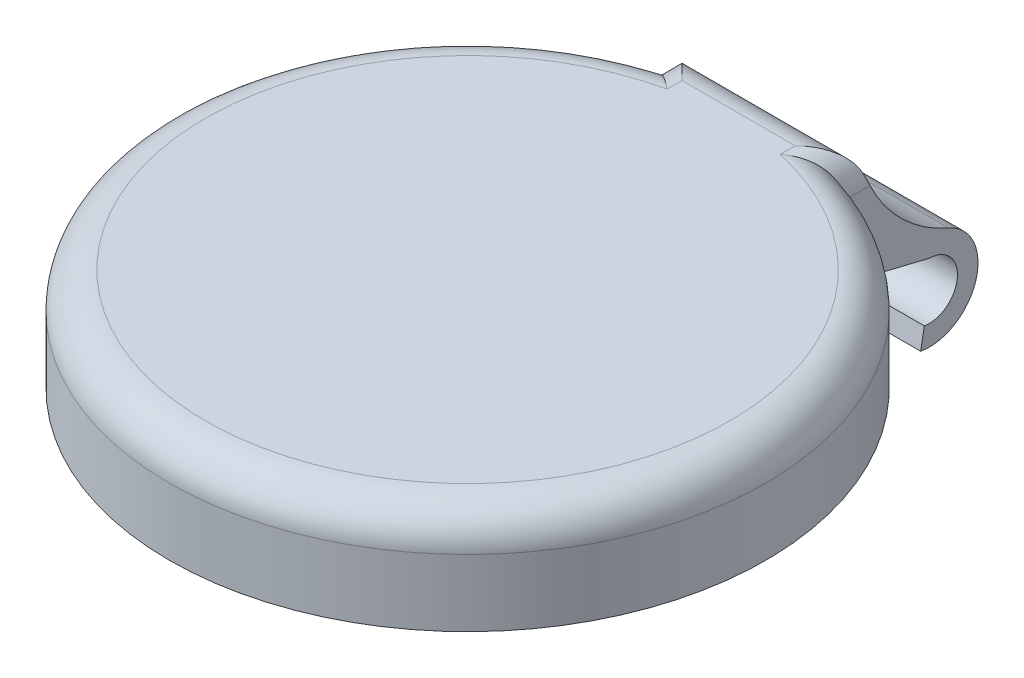
from build123d import *

# Parameters (mm, degrees)
BOSS_EXTRUDE1_DEPTH = 10
BOSS_EXTRUDE2_DEPTH = 18
FILLET3_R           = 15
FILLET4_R           = 3.5
SKETCH13_R          = 24
CUT_EXTRUDE1_DEPTH  = 5
FILLET6_R           = 15


with BuildPart() as part:
    # Sketch1 → Boss-Extrude1 (new body)
    with BuildSketch(Plane(origin=(0, 0, 0), x_dir=(1, 0, 0), z_dir=(0, 1, 0))):
        with BuildLine():
            Line((-9, 27.568097504), (-9, 29))
            Line((-9, 29), (9, 29))
            Line((9, 29), (9, 27.568097504))
            ThreePointArc((9, 27.568097504), (0, -29), (-9, 27.568097504))
        make_face()
    extrude(amount=BOSS_EXTRUDE1_DEPTH)

    # Sketch2 → Boss-Extrude2 (add)
    with BuildSketch(Plane(origin=(9, 0, 0), x_dir=(0, 0, -1), z_dir=(1, 0, 0))):
        with BuildLine():
            ThreePointArc((35.9, -2.5), (38.63953542, -5.489678293), (35.422467511, -7.958221321))
            Line((35.422467511, -7.958221321), (35.075171156, -9.927836827))
            ThreePointArc((35.075171156, -9.927836827), (40.631924816, -5.663989778), (35.9, -0.5))
            Line((35.9, -0.5), (29, -0.5))
            Line((29, -0.5), (29, 0))
            Line((29, 0), (27.568097504, 0))
            Line((27.568097504, 0), (25.568097504, 0))
            Line((25.568097504, 0), (35.9, -2.5))
        make_face()
    extrude(amount=-BOSS_EXTRUDE2_DEPTH)

    # Fillet3
    # the kernel refuses this fillet: 15 mm, written as the material it adds along each edge
    with BuildSketch(Plane(origin=(9, -0.5, -29), x_dir=(0, -0.04416525302112601, -0.9990242391581797), z_dir=(-1, 0, 0))) as fillet3_piece_1_section:
        with BuildLine():
            CenterArc((14.114193119, -14.023025969), FILLET3_R, 110.793105877, 55.582764188)
            Line((-0.463735157, -10.489754511), (-1.921527984, -10.136427365))
            ThreePointArc((-1.921527984, -10.136427365), (-1.730403937, -5.178629376), (-1.498536359, 0.06624788))
            Line((-1.498536359, 0.06624788), (0.06624788, 1.498536359))
            ThreePointArc((0.06624788, 1.498536359), (6.95951513, 1.193796113), (8.256784252, 1.402302597))
            Line((8.256784252, 1.402302597), (8.789275967, 0))
        make_face()
    fillet3_piece_1 = extrude(amount=18, mode=Mode.PRIVATE)
    fillet3_piece_1 = split(fillet3_piece_1, bisect_by=Plane(origin=(0, -2.614058352, -36.371375907), z_dir=(0, 0.9719513305344294, -0.23518208067867855)), keep=Keep.TOP, mode=Mode.PRIVATE)
    add(fillet3_piece_1)

    # Fillet4
    fillet4_edges = [part.edges().sort_by_distance(p)[0] for p in [
        (0, 10, -29),
        (-9, 10, -28.284048752),
        (0, 10, 29),
        (9, 10, -28.284048752),
    ]]
    fillet(fillet4_edges, radius=FILLET4_R)

    # Sketch13 → Cut-Extrude1 (cut)
    with BuildSketch(Plane.XZ):
        with Locations(Location((0, 0, 0), (0, 0, 270))):
            Circle(SKETCH13_R)
    extrude(amount=-CUT_EXTRUDE1_DEPTH, mode=Mode.SUBTRACT)

    # Fillet6
    # the kernel refuses this fillet: 15 mm, written as the material it adds along each edge
    with BuildSketch(Plane(origin=(0, 5, 0), x_dir=(0, 0, -1), z_dir=(-1, 0, 0))) as fillet6_piece_1:
        with BuildLine():
            CenterArc((12.819660113, 15), FILLET6_R, 270, 48.189685104)
            Line((12.819660113, 0), (12.819660113, -0.3))
            Line((12.819660113, -0.3), (24, -0.3))
            Line((24, -0.3), (24.3, 0))
            ThreePointArc((24.3, 0), (24.3, 2.5), (24.223606798, 4.8))
            Line((24.223606798, 4.8), (24, 5))
        make_face()
    revolve(axis=Axis((0, 5, 0), (0, -1, 0)))


solid = part.part
